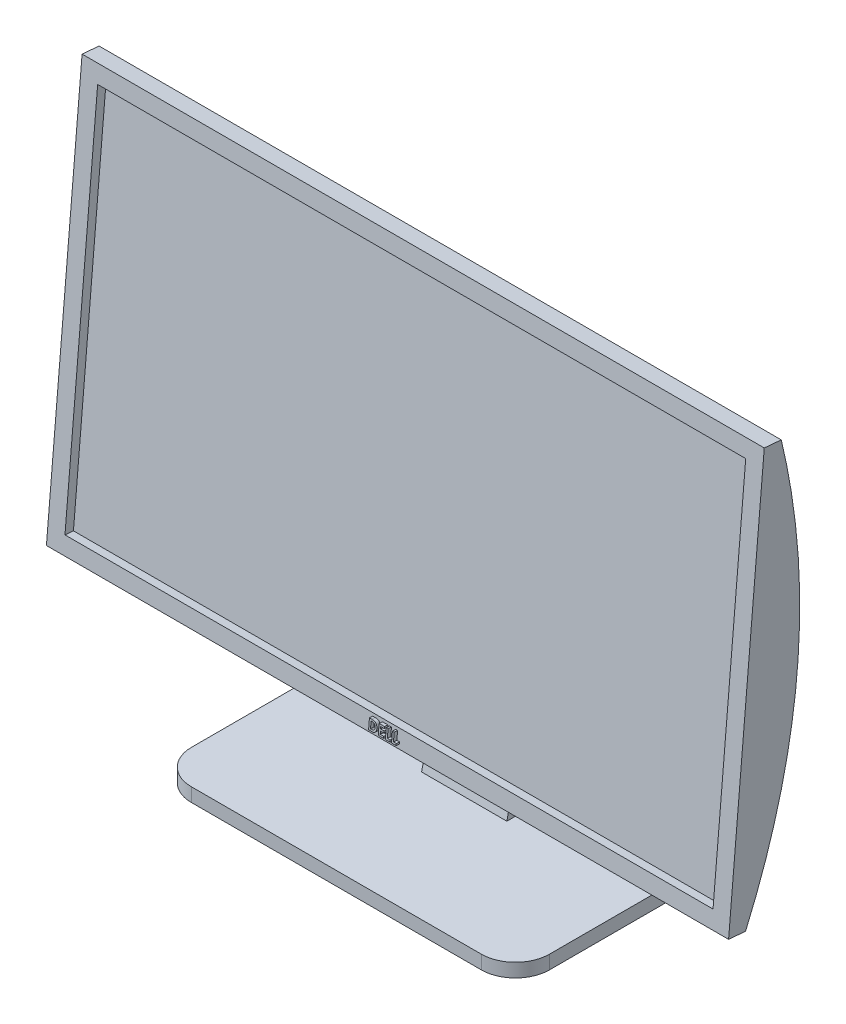
from build123d import *

# Parameters (mm, degrees)
SKETCH1_W           = 266.7
SKETCH1_H           = 152.4
BOSS_EXTRUDE1_DEPTH = 10.16
BOSS_EXTRUDE3_DEPTH = 254
SKETCH6_W           = 482.6
SKETCH6_H           = 279.4
CUT_EXTRUDE1_DEPTH  = 6.35
LOFT1_START         = -31.75
LOFT1_DEPTH         = 63.5
BOSS_EXTRUDE4_REACH = 463.798
SKETCH7_2_W         = 63.5
SKETCH7_2_H         = 12.7
FILLET4_R           = 25.4
BOSS_EXTRUDE5_DEPTH = 2.54


# Read off the part's stored shape, not the designer's step: Loft1
with BuildPart() as part:
    # Sketch1 → Boss-Extrude1 (new body)
    with BuildSketch(Plane(origin=(0, 0, 0), x_dir=(1, 0, 0), z_dir=(0, 1, 0))):
        Rectangle(SKETCH1_W, SKETCH1_H)
    extrude(amount=BOSS_EXTRUDE1_DEPTH)

    # Loft1 outline → Loft1 (add)
    with BuildSketch(Plane.YZ.offset(LOFT1_START)):
        with BuildLine():
            Line((10.16, -19.05), (10.16, -31.75))
            add(Edge.make_bspline(
                [(10.16, -31.75), (28.965309161, -35.285855321), (52.902221104, -39.786576725), (90.992153833, -42.855395332), (120.526662629, -43.520710588), (158.632305833, -41.305063295), (187.826991891, -37.239656645), (225.166907406, -29.818418758), (248.281057243, -22.646287688), (266.440292521, -17.011625957)],
                knots=[0, 0, 0, 0, 0.219947035, 0.279966299, 0.439970653, 0.559991905, 0.720003625, 0.780025652, 1, 1, 1, 1], degree=3))
            Line((266.440292521, -17.011625957), (253.788619855, -15.904748024))
            add(Edge.make_bspline(
                [(10.16, -19.05), (27.75631541, -23.030622259), (50.154322743, -28.097478842), (85.975275474, -32.459987698), (113.853351235, -34.286596432), (150.017339583, -33.849624359), (177.910203308, -31.332603381), (213.761877453, -26.061191443), (236.17787553, -20.373323721), (253.788619855, -15.904748024)],
                knots=[0, 0, 0, 0, 0.219947035, 0.279966299, 0.439970653, 0.559991905, 0.720003625, 0.780025652, 1, 1, 1, 1], degree=3))
        make_face()
    extrude(amount=LOFT1_DEPTH)


with BuildPart() as body_2:
    # Sketch5 → Boss-Extrude3 (new, symmetric)
    with BuildSketch(Plane(origin=(0, 0, 0), x_dir=(0, 0, -1), z_dir=(1, 0, 0))):
        with BuildLine():
            Line((-38.1, 73.66), (-25.448327334, 72.553122067))
            add(Edge.make_bspline(
                [(1.116743055, 376.193266045), (38.440898524, 219.945682325), (-25.448327334, 72.553122067)],
                knots=[0, 0, 0, 1, 1, 1], degree=2))
            Line((1.116743055, 376.193266045), (-11.534929611, 377.300143978))
            Line((-11.534929611, 377.300143978), (-38.1, 73.66))
        make_face()
    extrude(amount=BOSS_EXTRUDE3_DEPTH, both=True)

    # Sketch6 → Cut-Extrude1 (cut)
    with BuildSketch(Plane(origin=(0, 3.867528241, 44.206050078), x_dir=(1, 0, 0), z_dir=(0, 0.08715574274765818, 0.9961946980917455))):
        with Locations((0, 222.459067663)):
            Rectangle(SKETCH6_W, SKETCH6_H)
    extrude(amount=-CUT_EXTRUDE1_DEPTH, mode=Mode.SUBTRACT)

    # Sketch7<2> → Boss-Extrude4 (add, up to next)
    with BuildSketch(Plane(origin=(0, 0.546894442, 6.251032081), x_dir=(1, 0, 0), z_dir=(0, 0.08715574274765883, 0.9961946980917455)), mode=Mode.PRIVATE) as boss_extrude4_sk1:
        with Locations((0, 260.559067663)):
            Rectangle(SKETCH7_2_W, SKETCH7_2_H)
    boss_extrude4_tool1 = extrude(boss_extrude4_sk1.sketch, amount=BOSS_EXTRUDE4_REACH, mode=Mode.PRIVATE) - body_2.part

    add(part.part)  # Boss-Extrude4 merges part
    add(boss_extrude4_tool1.solids().sort_by_distance((0, 260.114456, -16.458187))[0])

    # Fillet4
    fillet4_edges = [body_2.edges().sort_by_distance(p)[0] for p in [
        (133.35, 5.08, 76.2),
        (133.35, 5.08, -76.2),
        (-133.35, 5.08, -76.2),
        (-133.35, 5.08, 76.2),
    ]]
    fillet(fillet4_edges, radius=FILLET4_R)

    # Sketch9 → Boss-Extrude5 (add)
    # profile 1 of 4: a face of its own
    with BuildSketch(Plane(origin=(0, 3.867528241, 44.206050078), x_dir=(1, 0, 0), z_dir=(0, 0.08715574274765818, 0.9961946980917455))):
        with BuildLine():
            Line((-11.845192308, 80.642400996), (-10.169709869, 80.642400996))
            add(Edge.make_bspline(
                [(-10.169709869, 80.642400996), (-10.039086742, 80.641487896), (-9.786590759, 80.639722862), (-9.420774033, 80.619835181), (-9.080611029, 80.58924934), (-8.76588247, 80.547172972), (-8.477233602, 80.491494415), (-8.215036632, 80.421656578), (-7.978411563, 80.341040413), (-7.76476385, 80.246179137), (-7.569724038, 80.13558031), (-7.384527512, 80.012382096), (-7.2095379, 79.872071384), (-7.042299501, 79.717355048), (-6.884970561, 79.545402599), (-6.73493099, 79.359062194), (-6.595854438, 79.155631639), (-6.46353692, 78.939988558), (-6.343873333, 78.711219076), (-6.23949828, 78.47127043), (-6.152062666, 78.221686781), (-6.081016701, 77.962202136), (-6.024384868, 77.693677905), (-5.984760716, 77.415572233), (-5.96026467, 77.128142598), (-5.957779751, 76.933337422), (-5.956517094, 76.83435145)],
                knots=[0, 0, 0, 0, 1.44355588, 2.790409838, 4.047694926, 5.217575253, 6.298404546, 7.294384826, 8.214239204, 9.058592145, 9.873746385, 10.689560431, 11.514393297, 12.350027578, 13.205127629, 14.088021785, 14.991911688, 15.926770944, 16.882954281, 17.842803888, 18.816321264, 19.80318086, 20.814351908, 21.847355356, 22.906180909, 24, 24, 24, 24], degree=3))
            add(Edge.make_bspline(
                [(-5.956517094, 76.83435145), (-5.959823412, 76.694675801), (-5.966332092, 76.419716111), (-6.021157576, 76.016215932), (-6.109828948, 75.629420767), (-6.23450895, 75.262356277), (-6.389078777, 74.918291224), (-6.573729744, 74.603293052), (-6.785754438, 74.319052512), (-7.022682758, 74.066984889), (-7.279218425, 73.85032935), (-7.545810714, 73.664779736), (-7.825056719, 73.518458383), (-8.071111475, 73.425668764), (-8.284471646, 73.367961649), (-8.471799567, 73.333856188), (-8.684584973, 73.302579424), (-8.924811901, 73.278409413), (-9.191426528, 73.256855703), (-9.485491584, 73.245144256), (-9.80605497, 73.235413782), (-10.028716551, 73.234528126), (-10.14448117, 73.234067663)],
                knots=[0, 0, 0, 0, 1.315458931, 2.589557908, 3.828601765, 5.048913369, 6.235739168, 7.376350998, 8.481830359, 9.569842114, 10.627874879, 11.640079404, 12.624025415, 13.590060155, 14.111227486, 14.704434459, 15.382649715, 16.137166398, 16.978595427, 17.902333227, 18.909396075, 20, 20, 20, 20], degree=3))
            Line((-10.14448117, 73.234067663), (-11.845192308, 73.234067663))
            Line((-11.845192308, 73.234067663), (-11.845192308, 80.642400996))
        make_face()
        with BuildLine():
            Line((-10.515491453, 79.312700141), (-10.515491453, 74.563768517))
            Line((-10.515491453, 74.563768517), (-9.820960203, 74.563768517))
            add(Edge.make_bspline(
                [(-9.820960203, 74.563768517), (-9.738321651, 74.563919946), (-9.579380204, 74.564211192), (-9.349904733, 74.578083516), (-9.137698107, 74.592007503), (-8.943344483, 74.618435698), (-8.765429413, 74.647874846), (-8.606396987, 74.688843453), (-8.462968854, 74.731877503), (-8.336896961, 74.786665183), (-8.221425379, 74.848332363), (-8.114511884, 74.920582613), (-8.011310428, 75.000813792), (-7.913750445, 75.091385611), (-7.821462695, 75.19109873), (-7.734993209, 75.300466927), (-7.65318785, 75.419156515), (-7.578146405, 75.547795036), (-7.509573132, 75.685024038), (-7.448740954, 75.829514259), (-7.398302102, 75.982468991), (-7.356380416, 76.142456392), (-7.326422619, 76.310869336), (-7.301638255, 76.486460411), (-7.288861193, 76.669925294), (-7.287107621, 76.794760931), (-7.286217949, 76.858096108)],
                knots=[0, 0, 0, 0, 1.50275155, 2.890291501, 4.180787663, 5.369391935, 6.45668281, 7.458360028, 8.354766181, 9.177074746, 9.954075863, 10.732690366, 11.5210699, 12.329727389, 13.151100085, 13.990027547, 14.863562427, 15.770965086, 16.696477834, 17.652329173, 18.619756807, 19.62365428, 20.657822005, 21.729286259, 22.847956731, 24, 24, 24, 24], degree=3))
            add(Edge.make_bspline(
                [(-7.286217949, 76.858096108), (-7.287989874, 76.955151279), (-7.29144499, 77.144401343), (-7.324765386, 77.420048191), (-7.379004633, 77.679610993), (-7.456398814, 77.922126441), (-7.553956576, 78.14827613), (-7.676072858, 78.356144094), (-7.817492245, 78.549222228), (-7.929322837, 78.662488057), (-7.985201322, 78.719083688)],
                knots=[0, 0, 0, 0, 1.13821349, 2.219428113, 3.251817212, 4.244760574, 5.201143372, 6.134805572, 7.068016741, 8, 8, 8, 8], degree=3))
            add(Edge.make_bspline(
                [(-7.985201322, 78.719083688), (-8.0403028, 78.767310817), (-8.152841329, 78.865809267), (-8.350422003, 78.9838356), (-8.568145674, 79.087533301), (-8.810993205, 79.169754014), (-9.076617583, 79.234777659), (-9.366600873, 79.279622877), (-9.679390151, 79.308439938), (-9.896083274, 79.31124965), (-10.007949386, 79.312700141)],
                knots=[0, 0, 0, 0, 0.813307809, 1.661089106, 2.549956539, 3.493439533, 4.508053171, 5.589449661, 6.755572447, 8, 8, 8, 8], degree=3))
            Line((-10.007949386, 79.312700141), (-10.515491453, 79.312700141))
        make_face(mode=Mode.SUBTRACT)
    # profile 2 of 4: a face of its own
    with BuildSketch(Plane(origin=(0, 3.867528241, 44.206050078), x_dir=(1, 0, 0), z_dir=(0, 0.08715574274765818, 0.9961946980917455))):
        Polygon((-4.626816239, 80.642400996), (-0.637713675, 80.642400996), (-0.637713675, 79.312700141), (-3.297115385, 79.312700141), (-3.297115385, 77.888020654), (-0.637713675, 77.888020654), (-0.637713675, 76.5583198), (-3.297115385, 76.5583198), (-3.297115385, 74.563768517), (-0.637713675, 74.563768517), (-0.637713675, 73.234067663), (-4.626816239, 73.234067663), align=None)
    # profile 3 of 4: a face of its own
    with BuildSketch(Plane(origin=(0, 3.867528241, 44.206050078), x_dir=(1, 0, 0), z_dir=(0, 0.08715574274765818, 0.9961946980917455))):
        Polygon((0.691987179, 80.642400996), (2.021688034, 80.642400996), (2.021688034, 74.563768517), (4.111217949, 74.563768517), (4.111217949, 73.234067663), (0.691987179, 73.234067663), align=None)
    # profile 4 of 4: a face of its own
    with BuildSketch(Plane(origin=(0, 3.867528241, 44.206050078), x_dir=(1, 0, 0), z_dir=(0, 0.08715574274765818, 0.9961946980917455))):
        Polygon((5.250961538, 80.642400996), (6.580662393, 80.642400996), (6.580662393, 74.563768517), (8.670192308, 74.563768517), (8.670192308, 73.234067663), (5.250961538, 73.234067663), align=None)
    extrude(amount=BOSS_EXTRUDE5_DEPTH)


solid = body_2.part
